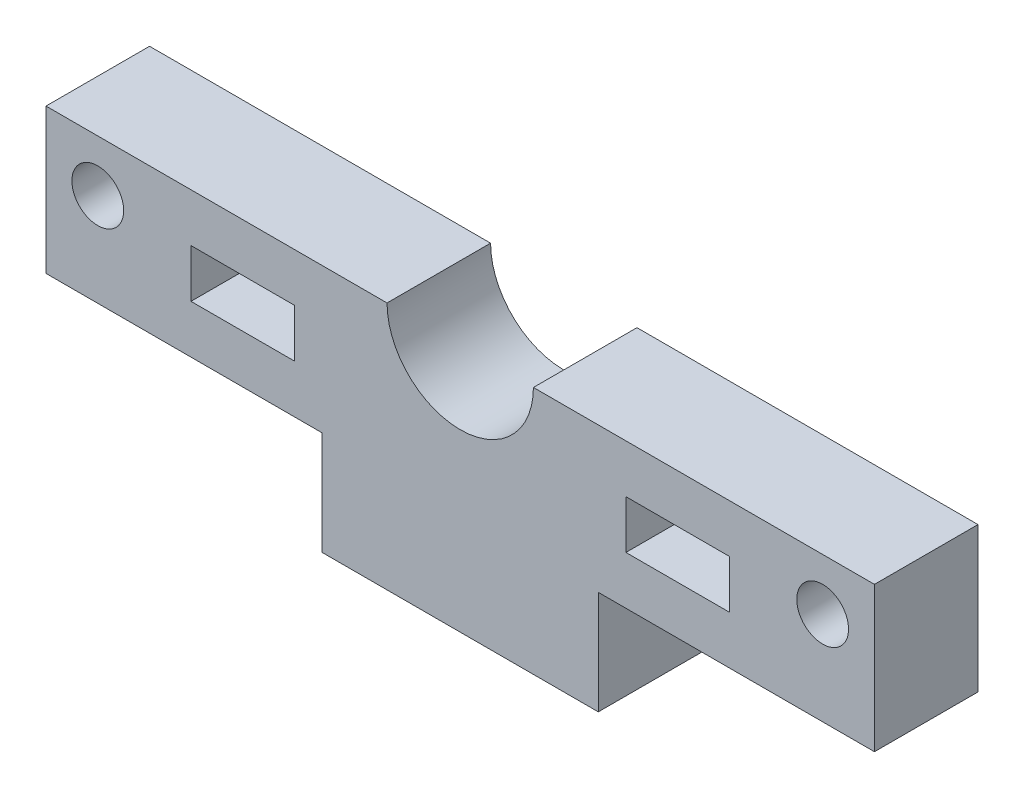
from build123d import *

# Parameters (mm, degrees)
BOSS_EXTRUDE1_DEPTH = 6.35
SKETCH2_R           = 1.5875
CUT_EXTRUDE1_DEPTH  = 53.694769397
SKETCH3_R           = 4.48798261
CUT_EXTRUDE2_DEPTH  = 53.694769397
CAVITY1_START       = 6.554367816
CAVITY1_OUTLINE_W   = 6.35
CAVITY1_OUTLINE_H   = 6.35
CAVITY1_DEPTH       = 2.963333333


# Read off the part's stored shape, not the designer's step: Cavity1
with BuildPart() as part:
    # Sketch1 → Boss-Extrude1 (new body)
    with BuildSketch(Plane.XY):
        Polygon((16.933333333, -2.758965517), (33.866666667, -2.758965517), (33.866666667, 3.591034483), (50.8, 3.591034483), (50.8, 12.481034483), (0, 12.481034483), (0, 3.591034483), (16.933333333, 3.591034483), align=None)
    extrude(amount=BOSS_EXTRUDE1_DEPTH)

    # Sketch2 → Cut-Extrude1 (cut, through all)
    with BuildSketch(Plane(origin=(0, 0, 0), x_dir=(-1, 0, 0), z_dir=(0, 0, -1))):
        with Locations((-47.625, 9.306034483)):
            Circle(SKETCH2_R)
        with Locations((-3.175, 9.306034483)):
            Circle(SKETCH2_R)
    extrude(amount=-CUT_EXTRUDE1_DEPTH, mode=Mode.SUBTRACT)

    # Sketch3 → Cut-Extrude2 (cut, through all)
    with BuildSketch(Plane(origin=(0, 0, 0), x_dir=(-1, 0, 0), z_dir=(0, 0, -1))):
        with Locations((-25.4, 12.481034483)):
            Circle(SKETCH3_R)
    extrude(amount=-CUT_EXTRUDE2_DEPTH, mode=Mode.SUBTRACT)

    # Cavity1 outline → Cavity1 (cut)
    with BuildSketch(Plane(origin=(0, 0, 0), x_dir=(1, 0, 0), z_dir=(0, 1, 0)).offset(CAVITY1_START)):
        with Locations((38.735, -3.175)):
            Rectangle(CAVITY1_OUTLINE_W, CAVITY1_OUTLINE_H)
        with Locations((12.065, -3.175)):
            Rectangle(CAVITY1_OUTLINE_W, CAVITY1_OUTLINE_H)
    extrude(amount=CAVITY1_DEPTH, mode=Mode.SUBTRACT)


solid = part.part
